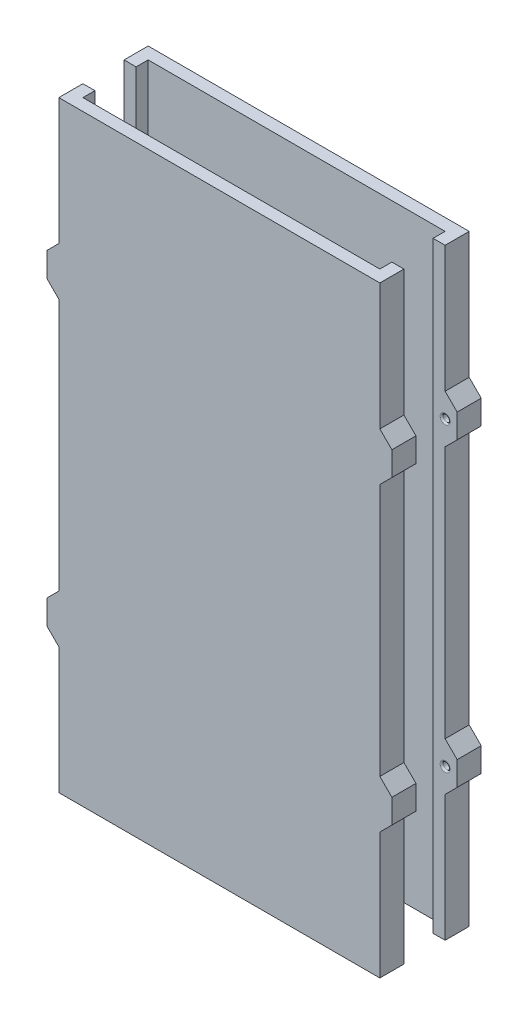
from build123d import *

# Parameters (mm, degrees)
SKETCH1_W             = 40
SKETCH1_H             = 75
BOSS_EXTRUDE1_DEPTH   = 3
SHELL2_T              = -1.5
SNAP_START            = 17.75
SNAP_HOOK1_DEPTH      = 0.75
SNAP_HOOK1_2_DEPTH    = 0.75
SNAP_GROOVE1_DEPTH    = 1.25
SNAP_GROOVE1_2_DEPTH  = 0.875
MIRROR8_START         = -18.5
MIRROR8_DEPTH         = 0.75
MIRROR8_START_2       = 17.75
MIRROR8_2_DEPTH       = 0.75
MIRROR8_3_DEPTH       = 0.75
MIRROR8_4_DEPTH       = 0.75
MIRROR9_START         = 17.75
MIRROR9_COPY_1_DEPTH  = 1.25
MIRROR9_COPY_2_DEPTH  = 0.875
FILLET1_R             = 1
BOSS_EXTRUDE3_DEPTH   = 3
BOSS_EXTRUDE3_2_DEPTH = 3
BOSS_EXTRUDE3_3_DEPTH = 3
BOSS_EXTRUDE3_4_DEPTH = 3
SKETCH6_R             = 0.4
BOSS_EXTRUDE4_DEPTH   = 1
FILLET2_R             = 0.2
SKETCH7_R             = 0.425
CUT_EXTRUDE1_DEPTH    = 1
FILLET3_R             = 0.2


with BuildPart() as part:
    # Sketch1 → Boss-Extrude1 (new body)
    with BuildSketch(Plane.XY):
        Rectangle(SKETCH1_W, SKETCH1_H)
    extrude(amount=BOSS_EXTRUDE1_DEPTH)

    # Shell2
    shell2_openings = [part.faces().sort_by_distance(p)[0] for p in [
        (0, 0, 0),
        (0, -37.5, 1.5),
        (0, 37.5, 1.5),
    ]]
    offset(amount=SHELL2_T, openings=shell2_openings, kind=Kind.INTERSECTION)


with BuildPart() as body_2:
    # Mirror3: mirrored copy
    add(part.part.mirror(Plane.XY))

    # Snap Groove1: read off the stored shape, not the designer's step
    # Snap Groove1 outline → Snap Groove1 (cut)
    with BuildSketch(Plane.YZ.offset(SNAP_START)):
        Polygon((19.861898055, -1.75), (19.901203889, -1), (17.59879611, -1), (17.638101945, -1.75), align=None)
    snap_groove1 = extrude(amount=SNAP_GROOVE1_DEPTH, mode=Mode.SUBTRACT)

    # Snap Groove1 2 outline → Snap Groove1 2 (cut)
    with BuildSketch(Plane.YZ.offset(SNAP_START)):
        Polygon((17.59879611, -1), (19.90120389, -1), (19.927407779, -0.5), (17.572592221, -0.5), align=None)
    snap_groove1_2 = extrude(amount=SNAP_GROOVE1_2_DEPTH, mode=Mode.SUBTRACT)

    # Mirror7: Snap Groove1, Snap Groove1 2 across plane
    add(snap_groove1.mirror(Plane(origin=(0, 0, 0), x_dir=(0, 0, 1), z_dir=(1, 0, 0))), mode=Mode.SUBTRACT)
    add(snap_groove1_2.mirror(Plane(origin=(0, 0, 0), x_dir=(0, 0, 1), z_dir=(1, 0, 0))), mode=Mode.SUBTRACT)

    # Mirror9: Snap Groove1, Snap Groove1 2 across plane
    add(snap_groove1.mirror(Plane.ZX), mode=Mode.SUBTRACT)
    add(snap_groove1_2.mirror(Plane.ZX), mode=Mode.SUBTRACT)

    # Mirror9 copy 1 sketch → Mirror9 copy 1 (cut)
    with BuildSketch(Plane(origin=(0, 0, 0), x_dir=(0, -1, 0), z_dir=(-1, 0, 0)).offset(MIRROR9_START)):
        Polygon((19.861898055, -1.75), (19.901203889, -1), (17.59879611, -1), (17.638101945, -1.75), align=None)
    extrude(amount=MIRROR9_COPY_1_DEPTH, mode=Mode.SUBTRACT)

    # Mirror9 copy 2 sketch → Mirror9 copy 2 (cut)
    with BuildSketch(Plane(origin=(0, 0, 0), x_dir=(0, -1, 0), z_dir=(-1, 0, 0)).offset(MIRROR9_START)):
        Polygon((17.59879611, -1), (19.90120389, -1), (19.927407779, -0.5), (17.572592221, -0.5), align=None)
    extrude(amount=MIRROR9_COPY_2_DEPTH, mode=Mode.SUBTRACT)


with BuildPart() as part_1:
    add(part.part)

    # Snap Hook1: read off the stored shape, not the designer's step
    # Snap Hook1 outline → Snap Hook1 (add)
    with BuildSketch(Plane.YZ.offset(SNAP_START)):
        Polygon((17.72379611, -1), (17.75, -1.5), (19.75, -1.5), (19.77620389, -1), align=None)
    snap_hook1 = extrude(amount=SNAP_HOOK1_DEPTH)

    # Snap Hook1 2 outline → Snap Hook1 2 (add)
    with BuildSketch(Plane.YZ.offset(SNAP_START)):
        Polygon((17.72379611, -1), (19.77620389, -1), (19.907223338, 1.5), (17.592776662, 1.5), align=None)
    snap_hook1_2 = extrude(amount=SNAP_HOOK1_2_DEPTH)

    # Snap Hook1 3: loft between two sections, ruled curve by curve
    snap_hook1_3_from = [
        Edge.make_line((18.5, 17.75, -1.5), (18.5, 19.75, -1.5)),
        Edge.make_line((18.5, 19.77620389, -1), (18.5, 17.72379611, -1)),
        Edge.make_line((18.5, 19.77620389, -1), (18.5, 19.75, -1.5)),
        Edge.make_line((18.5, 17.72379611, -1), (18.5, 17.75, -1.5)),
    ]
    snap_hook1_3_to = [
        Edge.make_line((18.75, 17.736898055, -1.25), (18.75, 19.763101945, -1.25)),
        Edge.make_line((18.75, 19.77620389, -1), (18.75, 17.72379611, -1)),
        Edge.make_line((18.75, 19.77620389, -1), (18.75, 19.763101945, -1.25)),
        Edge.make_line((18.75, 17.72379611, -1), (18.75, 17.736898055, -1.25)),
    ]
    snap_hook1_3 = Solid(Shell([*[Face.make_surface_from_curves(snap_hook1_3_from[k], snap_hook1_3_to[k]) for k in range(4)], Face(Wire(snap_hook1_3_from)), Face(Wire(snap_hook1_3_to))]))
    add(snap_hook1_3)

    # Mirror6: Snap Hook1, Snap Hook1 2, Snap Hook1 3 across plane
    add(snap_hook1.mirror(Plane(origin=(0, 0, 0), x_dir=(0, 0, 1), z_dir=(1, 0, 0))))
    add(snap_hook1_2.mirror(Plane(origin=(0, 0, 0), x_dir=(0, 0, 1), z_dir=(1, 0, 0))))
    add(snap_hook1_3.mirror(Plane(origin=(0, 0, 0), x_dir=(0, 0, 1), z_dir=(1, 0, 0))))

    # Mirror8: read off the stored shape, not the designer's step
    # Mirror8 outline → Mirror8 (add)
    with BuildSketch(Plane.YZ.offset(MIRROR8_START)):
        Polygon((-19.77620389, -1), (-19.75, -1.5), (-17.75, -1.5), (-17.72379611, -1), align=None)
    extrude(amount=MIRROR8_DEPTH)

    # Mirror8 2 outline → Mirror8 2 (add)
    with BuildSketch(Plane.YZ.offset(MIRROR8_START_2)):
        Polygon((-19.77620389, -1), (-19.75, -1.5), (-17.75, -1.5), (-17.72379611, -1), align=None)
    extrude(amount=MIRROR8_2_DEPTH)

    # Mirror8 3 outline → Mirror8 3 (add)
    with BuildSketch(Plane.YZ.offset(MIRROR8_START)):
        Polygon((-19.77620389, -1), (-17.72379611, -1), (-17.592776662, 1.5), (-19.907223338, 1.5), align=None)
    extrude(amount=MIRROR8_3_DEPTH)

    # Mirror8 4 outline → Mirror8 4 (add)
    with BuildSketch(Plane.YZ.offset(MIRROR8_START_2)):
        Polygon((-19.77620389, -1), (-17.72379611, -1), (-17.592776662, 1.5), (-19.907223338, 1.5), align=None)
    extrude(amount=MIRROR8_4_DEPTH)

    # Mirror8 5: loft between two sections, ruled curve by curve
    mirror8_5_from = [
        Edge.make_line((18.5, -19.75, -1.5), (18.5, -17.75, -1.5)),
        Edge.make_line((18.5, -17.72379611, -1), (18.5, -19.77620389, -1)),
        Edge.make_line((18.5, -17.72379611, -1), (18.5, -17.75, -1.5)),
        Edge.make_line((18.5, -19.77620389, -1), (18.5, -19.75, -1.5)),
    ]
    mirror8_5_to = [
        Edge.make_line((18.75, -19.763101945, -1.25), (18.75, -17.736898055, -1.25)),
        Edge.make_line((18.75, -17.72379611, -1), (18.75, -19.77620389, -1)),
        Edge.make_line((18.75, -17.72379611, -1), (18.75, -17.736898055, -1.25)),
        Edge.make_line((18.75, -19.77620389, -1), (18.75, -19.763101945, -1.25)),
    ]
    mirror8_5 = Solid(Shell([*[Face.make_surface_from_curves(mirror8_5_from[k], mirror8_5_to[k]) for k in range(4)], Face(Wire(mirror8_5_from)), Face(Wire(mirror8_5_to))]))
    add(mirror8_5)

    # Mirror8 6: loft between two sections, ruled curve by curve
    mirror8_6_from = [
        Edge.make_line((-18.75, -17.72379611, -1), (-18.75, -19.77620389, -1)),
        Edge.make_line((-18.75, -19.763101945, -1.25), (-18.75, -17.736898055, -1.25)),
        Edge.make_line((-18.75, -19.763101945, -1.25), (-18.75, -19.77620389, -1)),
        Edge.make_line((-18.75, -17.736898055, -1.25), (-18.75, -17.72379611, -1)),
    ]
    mirror8_6_to = [
        Edge.make_line((-18.5, -17.72379611, -1), (-18.5, -19.77620389, -1)),
        Edge.make_line((-18.5, -19.75, -1.5), (-18.5, -17.75, -1.5)),
        Edge.make_line((-18.5, -19.75, -1.5), (-18.5, -19.77620389, -1)),
        Edge.make_line((-18.5, -17.75, -1.5), (-18.5, -17.72379611, -1)),
    ]
    mirror8_6 = Solid(Shell([*[Face.make_surface_from_curves(mirror8_6_from[k], mirror8_6_to[k]) for k in range(4)], Face(Wire(mirror8_6_from)), Face(Wire(mirror8_6_to))]))
    add(mirror8_6)

    # Fillet1
    fillet1_edges = [part_1.edges().sort_by_distance(p)[0] for p in [
        (-17.75, -18.75, 1.5),
        (17.75, 18.75, 1.5),
        (-17.75, 18.75, 1.5),
        (17.75, -18.75, 1.5),
    ]]
    fillet(fillet1_edges, radius=FILLET1_R)


with BuildPart() as body_3:
    # Sketch5 → Boss-Extrude3 (new body)
    with BuildSketch(Plane.XY.offset(3)):
        Polygon((20, 21.75), (21.5, 20.25), (21.5, 17.25), (20, 15.75), align=None)
    extrude(amount=-BOSS_EXTRUDE3_DEPTH)


with BuildPart() as body_4:
    # Sketch5 → Boss-Extrude3 2 (new body)
    with BuildSketch(Plane.XY.offset(3)):
        Polygon((-21.5, 17.25), (-20, 15.75), (-20, 21.75), (-21.5, 20.25), align=None)
    extrude(amount=-BOSS_EXTRUDE3_2_DEPTH)


with BuildPart() as body_5:
    # Sketch5 → Boss-Extrude3 3 (new body)
    with BuildSketch(Plane.XY.offset(3)):
        Polygon((21.5, -17.25), (20, -15.75), (20, -21.75), (21.5, -20.25), align=None)
    extrude(amount=-BOSS_EXTRUDE3_3_DEPTH)


with BuildPart() as body_6:
    # Sketch5 → Boss-Extrude3 4 (new body)
    with BuildSketch(Plane.XY.offset(3)):
        Polygon((-21.5, -20.25), (-21.5, -17.25), (-20, -15.75), (-20, -21.75), align=None)
    extrude(amount=-BOSS_EXTRUDE3_4_DEPTH)


with BuildPart() as body_7:
    # Mirror10: mirrored copy
    add(body_3.part.mirror(Plane.XY))


with BuildPart() as body_8:
    # Mirror10 2: mirrored copy
    add(body_4.part.mirror(Plane.XY))


with BuildPart() as body_9:
    # Mirror10 3: mirrored copy
    add(body_5.part.mirror(Plane.XY))


with BuildPart() as body_10:
    # Mirror10 4: mirrored copy
    add(body_6.part.mirror(Plane.XY))


with BuildPart() as part_2:
    add(part_1.part)

    # Combine2: union body 4, body 5, body 6, body 3
    add(body_4.part)
    add(body_5.part)
    add(body_6.part)
    add(body_3.part)

    # Sketch6 → Boss-Extrude4 (add)
    with BuildSketch(Plane(origin=(0, 0, 0), x_dir=(-1, 0, 0), z_dir=(0, 0, -1))):
        with Locations(Location((-20, 18.75, 0), (0, 0, 180))):
            Circle(SKETCH6_R)
        with Locations(Location((-20, -18.75, 0), (0, 0, 180))):
            Circle(SKETCH6_R)
        with Locations(Location((20, -18.75, 0), (0, 0, 180))):
            Circle(SKETCH6_R)
        with Locations(Location((20, 18.75, 0), (0, 0, 180))):
            Circle(SKETCH6_R)
    extrude(amount=BOSS_EXTRUDE4_DEPTH)

    # Fillet2
    fillet2_edges = [part_2.edges().sort_by_distance(p)[0] for p in [
        (-20.4, -18.75, 0),
        (-20.4, 18.75, 0),
        (19.6, 18.75, 0),
        (19.6, -18.75, 0),
        (-20.4, 18.75, -1),
        (-20.4, -18.75, -1),
        (19.6, -18.75, -1),
        (19.6, 18.75, -1),
    ]]
    fillet(fillet2_edges, radius=FILLET2_R)


with BuildPart() as body_7_1:
    add(body_7.part)

    # Combine3: union body 8, body 9, body 10, body 2
    add(body_8.part)
    add(body_9.part)
    add(body_10.part)
    add(body_2.part)


with BuildPart() as body_7_2:
    # Body-Move/Copy1: moved
    add(body_7_1.part.moved(Location((0, 0, -5.132920163))))

    # Sketch7 → Cut-Extrude1 (cut)
    with BuildSketch(Plane.XY.offset(-5.132920163)):
        with Locations((-20, -18.75)):
            Circle(SKETCH7_R)
        with Locations(Location((-20, 18.75, 0), (0, 0, 180))):
            Circle(SKETCH7_R)
        with Locations((20, 18.75)):
            Circle(SKETCH7_R)
        with Locations(Location((20, -18.75, 0), (0, 0, 180))):
            Circle(SKETCH7_R)
    extrude(amount=-CUT_EXTRUDE1_DEPTH, mode=Mode.SUBTRACT)

    # Fillet3
    fillet3_edges = [body_7_2.edges().sort_by_distance(p)[0] for p in [
        (20.425, -18.75, -6.132920163),
        (20.425, -18.75, -5.132920163),
        (19.575, 18.75, -6.132920163),
        (19.575, 18.75, -5.132920163),
        (-19.575, 18.75, -6.132920163),
        (-19.575, 18.75, -5.132920163),
        (-20.425, -18.75, -6.132920163),
        (-20.425, -18.75, -5.132920163),
    ]]
    fillet(fillet3_edges, radius=FILLET3_R)


solid = Compound([part_2.part, body_7_2.part])
